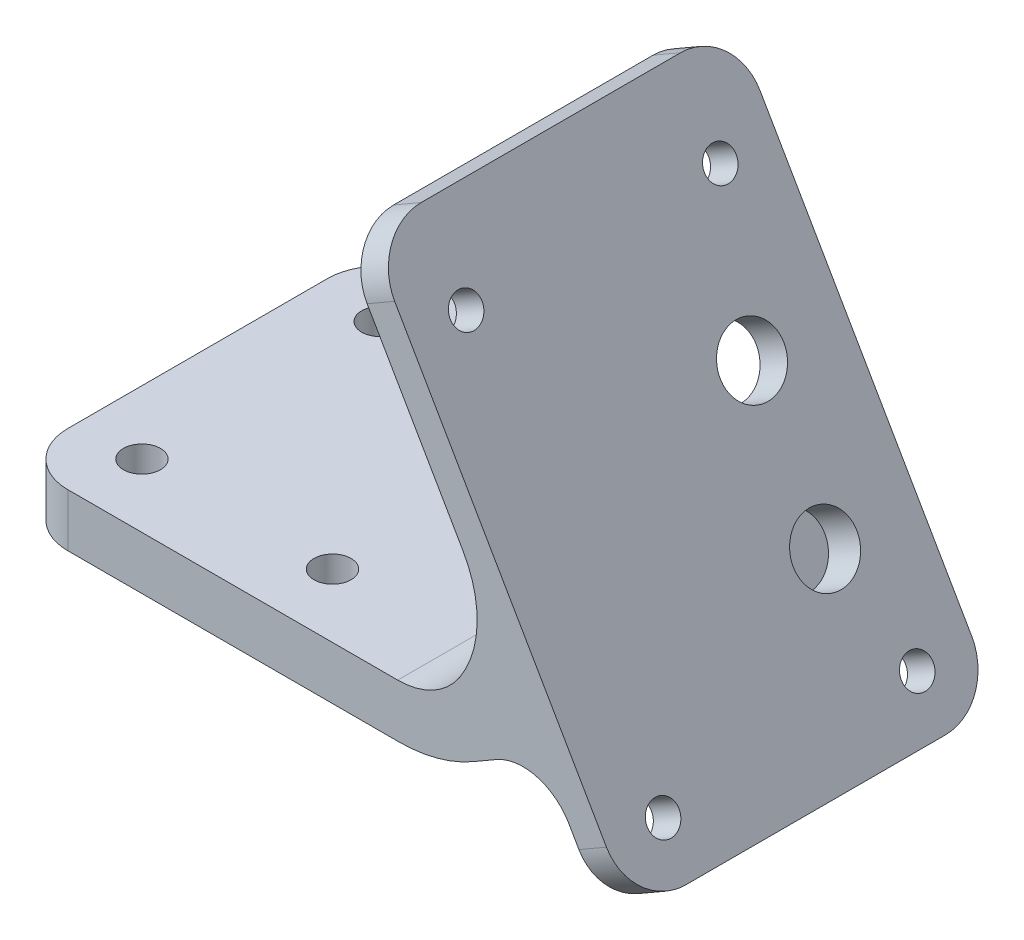
from build123d import *

# Parameters (mm, degrees)
P_IDAT_VYSUNUT_M1_DEPTH       = 34.5
SKICA2_R                      = 1.5
ODEBRAT_VYSUNUT_M1_DEPTH      = 3
SKICA4_R                      = 1.75
ODEBRAT_VYSUNUT_M2_DEPTH      = 5
SKICA6_W                      = 3
SKICA6_H                      = 34.5
P_IDAT_VYSUNUT_M3_DEPTH       = 1.6
SKICA7_W                      = 3
SKICA7_H                      = 34.5
ODEBRAT_VYSUNUT_M3_DEPTH      = 1.6
ZAOBLIT1_R                    = 5
ZAOBLIT2_R                    = 5
ZAOBLIT3_R                    = 10
ZAOBLIT4_R                    = 5
ZAOBLIT5_R                    = 7
ZAOBLIT6_R                    = 14
ODEBRAT_VYSUNUT_M5_REACH      = 64.381
ODEBRAT_VYSUNUT_M5_END_RADIUS = 10
SKICA8_R                      = 3
SKICA9_R                      = 3
ODEBRAT_VYSUNUT_M6_DEPTH      = 3.5


with BuildPart() as part:
    # Skica1 → Přidat vysunutím1 (new body)
    with BuildSketch(Plane.XY):
        Polygon((0, 0), (38.660254038, 0), (47.320508076, 5), (31.570508076, 32.279800219), (34.168584287, 33.779800219), (59.168584287, -9.52146997), (56.570508076, -11.02146997), (49.820508076, 0.669872981), (40, -5), (0, -5), align=None)
    extrude(amount=P_IDAT_VYSUNUT_M1_DEPTH)

    # Skica2 → Odebrat vysunutím1 (cut)
    with BuildSketch(Plane(origin=(40.253520778, 23.240381057, 0), x_dir=(0, 0, -1), z_dir=(0.8660254037844362, 0.5000000000000046, 0))):
        with Locations(Location((-29.25, 5.769872981, 0), (0, 0, 90))):
            Circle(SKICA2_R)
        with Locations(Location((-29.25, -31.430127019, 0), (0, 0, 90))):
            Circle(SKICA2_R)
        with Locations(Location((-5.25, 5.769872981, 0), (0, 0, 90))):
            Circle(SKICA2_R)
        with Locations(Location((-5.25, -31.430127019, 0), (0, 0, 90))):
            Circle(SKICA2_R)
    extrude(amount=-ODEBRAT_VYSUNUT_M1_DEPTH, mode=Mode.SUBTRACT)

    # Skica4 → Odebrat vysunutím2 (cut)
    with BuildSketch(Plane(origin=(0, 0, 0), x_dir=(1, 0, 0), z_dir=(0, 1, 0))):
        with Locations(Location((6, -6, 0), (0, 0, 270))):
            Circle(SKICA4_R)
        with Locations(Location((6, -28.5, 0), (0, 0, 270))):
            Circle(SKICA4_R)
        with Locations(Location((24, -28.5, 0), (0, 0, 270))):
            Circle(SKICA4_R)
        with Locations(Location((24, -6, 0), (0, 0, 270))):
            Circle(SKICA4_R)
    extrude(amount=-ODEBRAT_VYSUNUT_M2_DEPTH, mode=Mode.SUBTRACT)

    # Skica6 → Přidat vysunutím3 (add)
    with BuildSketch(Plane(origin=(-6.084936491, 10.539419162, 0), x_dir=(0.8660254037844357, 0.5000000000000052, 0), z_dir=(-0.5000000000000052, 0.8660254037844357, 0))):
        with Locations((44.980762114, -17.25)):
            Rectangle(SKICA6_W, SKICA6_H)
    extrude(amount=P_IDAT_VYSUNUT_M3_DEPTH)

    # Skica7 → Odebrat vysunutím3 (cut)
    with BuildSketch(Plane(origin=(18.915063509, -32.761851027, 0), x_dir=(0.8660254037844368, 0.5000000000000032, 0), z_dir=(0.5000000000000032, -0.8660254037844368, 0))):
        with Locations((44.980762114, 17.25)):
            Rectangle(SKICA7_W, SKICA7_H)
    extrude(amount=-ODEBRAT_VYSUNUT_M3_DEPTH, mode=Mode.SUBTRACT)

    # Zaoblit1
    zaoblit1_edges = [part.edges().sort_by_distance(p)[0] for p in [
        (32.069546181, 34.415440865, 0),
        (32.069546181, 34.415440865, 34.5),
        (57.069546181, -8.885829324, 34.5),
        (57.069546181, -8.885829324, 0),
    ]]
    fillet(zaoblit1_edges, radius=ZAOBLIT1_R)

    # Zaoblit2
    zaoblit2_edges = [part.edges().sort_by_distance(p)[0] for p in [
        (0, -2.5, 0),
        (0, -2.5, 34.5),
    ]]
    fillet(zaoblit2_edges, radius=ZAOBLIT2_R)

    # Zaoblit3
    zaoblit3_edges = [part.edges().sort_by_distance(p)[0] for p in [
        (47.320508076, 5, 17.25),
    ]]
    fillet(zaoblit3_edges, radius=ZAOBLIT3_R - 0.0001)  # a hair under: the kernel refuses the full size

    # Zaoblit4
    zaoblit4_edges = [part.edges().sort_by_distance(p)[0] for p in [
        (49.820508076, 0.669872981, 17.25),
    ]]
    fillet(zaoblit4_edges, radius=ZAOBLIT4_R)

    # Zaoblit5
    zaoblit5_edges = [part.edges().sort_by_distance(p)[0] for p in [
        (38.660254038, 0, 17.25),
    ]]
    fillet(zaoblit5_edges, radius=ZAOBLIT5_R)

    # Zaoblit6
    zaoblit6_edges = [part.edges().sort_by_distance(p)[0] for p in [
        (40, -5, 17.25),
    ]]
    fillet(zaoblit6_edges, radius=ZAOBLIT6_R)

    # Odebrat vysunutím5: up to this cylinder (the profile starts outside it)
    odebrat_vysunut_m5_end = Plane(origin=(33.660254038, 8.660254038, 8.7), z_dir=(0, 0, 1)) * Cylinder(ODEBRAT_VYSUNUT_M5_END_RADIUS, 149.762, mode=Mode.PRIVATE)
    # Skica8 → Odebrat vysunutím5 (cut, up to the surface)
    with BuildSketch(Plane(origin=(40.253520778, 23.240381057, 0), x_dir=(0, 0, -1), z_dir=(0.8660254037844367, 0.5000000000000033, 0)), mode=Mode.PRIVATE) as odebrat_vysunut_m5_sk1:
        with Locations(Location((-8.7, -7.130127019, 0), (0, 0, 90))):
            Circle(SKICA8_R)
    odebrat_vysunut_m5_tool1 = extrude(odebrat_vysunut_m5_sk1.sketch, amount=-ODEBRAT_VYSUNUT_M5_REACH, mode=Mode.PRIVATE) - odebrat_vysunut_m5_end
    add(odebrat_vysunut_m5_tool1.solids().sort_by_distance((43.818584, 17.06551, 8.7))[0], mode=Mode.SUBTRACT)

    # Skica9 → Odebrat vysunutím6 (cut)
    with BuildSketch(Plane(origin=(40.253520778, 23.240381057, 0), x_dir=(0, 0, -1), z_dir=(0.8660254037844367, 0.5000000000000033, 0))):
        with Locations(Location((-8.7, -20.930127019, 0), (0, 0, 90))):
            Circle(SKICA9_R)
    extrude(amount=-ODEBRAT_VYSUNUT_M6_DEPTH, mode=Mode.SUBTRACT)


solid = part.part
